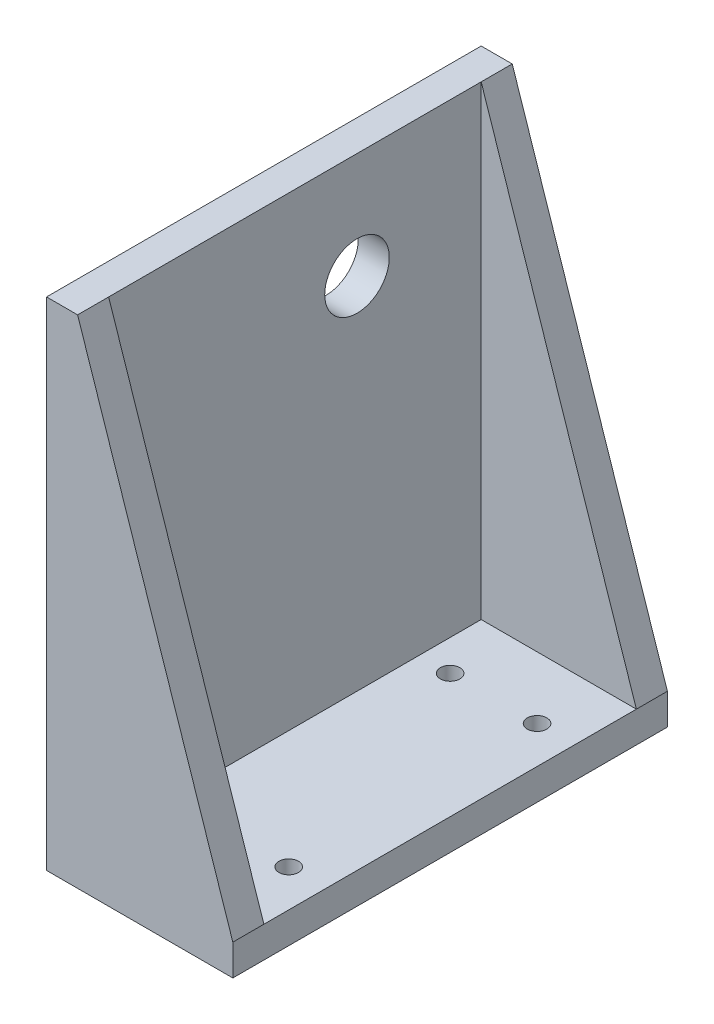
from build123d import *

# Parameters (mm, degrees)
BOSS_EXTRUDE1_DEPTH = 22.225
SKETCH2_R           = 3.302
CUT_EXTRUDE1_DEPTH  = 59.630138368
BOSS_EXTRUDE2_DEPTH = 3.175
SKETCH4_R           = 1.000000032
CUT_EXTRUDE2_DEPTH  = 56.901643536


with BuildPart() as part:
    # Sketch1 → Boss-Extrude1 (new, symmetric)
    with BuildSketch(Plane.XY):
        Polygon((0, 0), (0, 50.8), (3.175, 50.8), (3.175, 3.175), (19.05, 3.175), (19.05, 0), align=None)
    extrude(amount=BOSS_EXTRUDE1_DEPTH, both=True)

    # Sketch2 → Cut-Extrude1 (cut, through all)
    with BuildSketch(Plane.ZY):
        with Locations((-6.35, 39.9542)):
            Circle(SKETCH2_R)
    extrude(amount=-CUT_EXTRUDE1_DEPTH, mode=Mode.SUBTRACT)

    # Sketch3 → Boss-Extrude2 (add)
    with BuildSketch(Plane.XY.offset(22.225)):
        Polygon((3.175, 50.8), (19.05, 3.175), (3.175, 3.175), align=None)
    boss_extrude2 = extrude(amount=-BOSS_EXTRUDE2_DEPTH)

    # Mirror1: Boss-Extrude2 across plane
    add(boss_extrude2.mirror(Plane.XY))

    # Sketch4 → Cut-Extrude2 (cut, through all)
    with BuildSketch(Plane(origin=(0, 3.175, 0), x_dir=(1, 0, 0), z_dir=(0, 1, 0))):
        with Locations((6.35, 12.7)):
            Circle(SKETCH4_R)
        with Locations((15.24, 12.7)):
            Circle(SKETCH4_R)
        with Locations((15.24, -12.7)):
            Circle(SKETCH4_R)
        with Locations((6.35, -12.7)):
            Circle(SKETCH4_R)
    extrude(amount=-CUT_EXTRUDE2_DEPTH, mode=Mode.SUBTRACT)


solid = part.part
